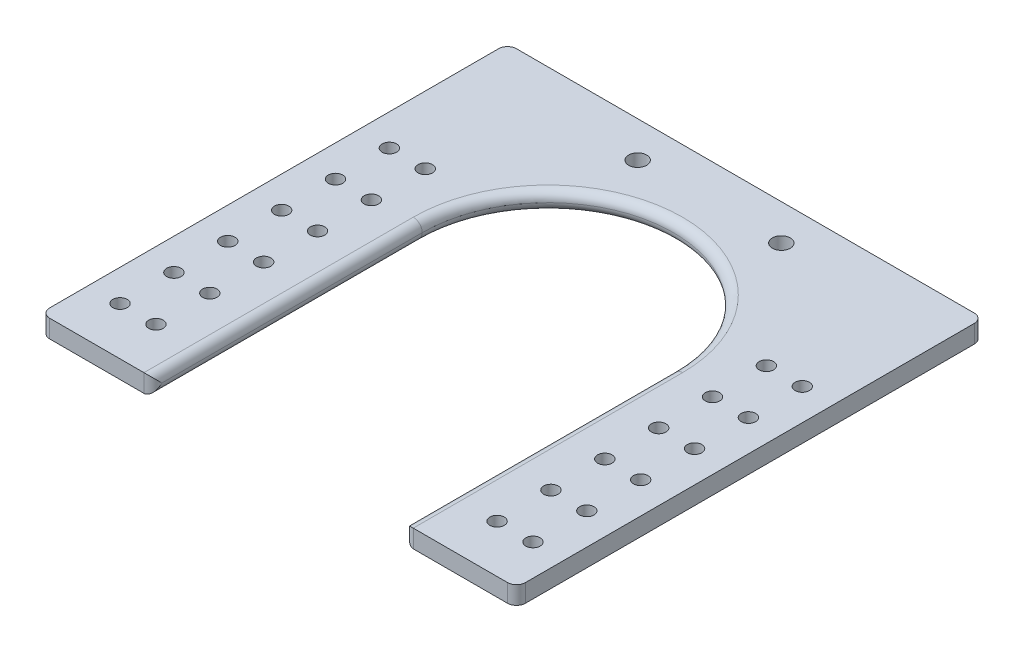
from build123d import *

# Parameters (mm, degrees)
SKETCH1_W                        = 168.275
SKETCH1_H                        = 165.1
BOSS_EXTRUDE1_DEPTH              = 3.175
CUT_EXTRUDE1_REACH               = 120.042
SKETCH2_R                        = 44.45
F_1_4_0_25_DIAMETER_HOLE1_D      = 6.35
F_1_4_0_25_DIAMETER_HOLE1_DEPTH  = 25.4
F_1_4_0_25_DIAMETER_HOLE1_TIP    = 1.907732465
F_1_4_20_TAPPED_HOLE1_AT_2_COUNT = 2
F_1_4_20_TAPPED_HOLE1_AT_2_PITCH = 12.7
LPATTERN1_COUNT                  = 6
LPATTERN1_PITCH                  = 19.05
FILLET1_R                        = 3.175
FILLET2_R                        = 3.175


with BuildPart() as part:
    # Sketch1 → Boss-Extrude1 (new, symmetric)
    with BuildSketch(Plane(origin=(0, 0, 0), x_dir=(1, 0, 0), z_dir=(0, 1, 0))):
        Rectangle(SKETCH1_W, SKETCH1_H)
    extrude(amount=BOSS_EXTRUDE1_DEPTH, both=True)

    # Sketch2 → Cut-Extrude1 (cut, up to next)
    with BuildSketch(Plane(origin=(0, 3.175, 0), x_dir=(1, 0, 0), z_dir=(0, 1, 0)), mode=Mode.PRIVATE) as cut_extrude1_sk1:
        with Locations((0, 12.7)):
            Circle(SKETCH2_R)
    cut_extrude1_tool1 = extrude(cut_extrude1_sk1.sketch, amount=-CUT_EXTRUDE1_REACH, mode=Mode.PRIVATE) & part.part
    # Sketch2 → Cut-Extrude1 (cut, up to next)
    with BuildSketch(Plane(origin=(0, 3.175, 0), x_dir=(1, 0, 0), z_dir=(0, 1, 0)), mode=Mode.PRIVATE) as cut_extrude1_sk2:
        with BuildLine():
            Line((44.45, -82.55), (44.45, 12.7))
            ThreePointArc((44.45, 12.7), (0, -31.75), (-44.45, 12.7))
            Line((-44.45, 12.7), (-44.45, -82.55))
            Line((-44.45, -82.55), (44.45, -82.55))
        make_face()
    cut_extrude1_tool2 = extrude(cut_extrude1_sk2.sketch, amount=-CUT_EXTRUDE1_REACH, mode=Mode.PRIVATE) & part.part
    add(cut_extrude1_tool1.solids().sort_by_distance((0, 3.175, -12.7))[0], mode=Mode.SUBTRACT)
    add(cut_extrude1_tool2.solids().sort_by_distance((0, 3.175, 51.564855))[0], mode=Mode.SUBTRACT)

    # 1/4 (0.25) Diameter Hole1
    with Locations(Plane(origin=(0, 3.175, 0), x_dir=(1, 0, 0), z_dir=(0, 1, 0))):
        with Locations((-25.4, 69.85), (25.4, 69.85)):
            Hole(F_1_4_0_25_DIAMETER_HOLE1_D / 2, depth=F_1_4_0_25_DIAMETER_HOLE1_DEPTH)
            with Locations((0, 0, -(F_1_4_0_25_DIAMETER_HOLE1_DEPTH + F_1_4_0_25_DIAMETER_HOLE1_TIP / 2))):  # 118° drill point
                Cone(0, F_1_4_0_25_DIAMETER_HOLE1_D / 2, F_1_4_0_25_DIAMETER_HOLE1_TIP, mode=Mode.SUBTRACT)

    # Sketch10 → 1/4-20 Tapped Hole1 (revolve, cut)
    with BuildSketch(Plane(origin=(-73.025, 3.175, 65.603705108), x_dir=(0, 0, 1), z_dir=(1, 0, 0))):
        Polygon((0, 0), (0, 26.933816902), (2.5527, 25.4), (2.5527, 0), align=None)
    f_1_4_20_tapped_hole1 = revolve(axis=Axis((-73.025, 9.525, 65.603705108), (0, -1, 0)), mode=Mode.SUBTRACT)

    # 1/4-20 Tapped Hole1 at 2: 1/4-20 Tapped Hole1 ×2
    with Locations(*[(i * F_1_4_20_TAPPED_HOLE1_AT_2_PITCH, 0, 0) for i in range(1, F_1_4_20_TAPPED_HOLE1_AT_2_COUNT)]):
        add(f_1_4_20_tapped_hole1, mode=Mode.SUBTRACT)

    # LPattern1: 1/4-20 Tapped Hole1 ×6
    with Locations(*[(0, 0, -i * LPATTERN1_PITCH) for i in range(1, LPATTERN1_COUNT)]):
        add(f_1_4_20_tapped_hole1, mode=Mode.SUBTRACT)

    # LPattern1 copy 1 sketch → LPattern1 copy 1 (revolve, cut)
    with BuildSketch(Plane(origin=(-60.325, 3.175, 46.553705108), x_dir=(0, 0, 1), z_dir=(1, 0, 0))):
        Polygon((0, 0), (0, 26.933816902), (2.5527, 25.4), (2.5527, 0), align=None)
    revolve(axis=Axis((-60.325, 9.525, 46.553705108), (0, -1, 0)), mode=Mode.SUBTRACT)

    # LPattern1 copy 2 sketch → LPattern1 copy 2 (revolve, cut)
    with BuildSketch(Plane(origin=(-60.325, 3.175, 27.503705108), x_dir=(0, 0, 1), z_dir=(1, 0, 0))):
        Polygon((0, 0), (0, 26.933816902), (2.5527, 25.4), (2.5527, 0), align=None)
    revolve(axis=Axis((-60.325, 9.525, 27.503705108), (0, -1, 0)), mode=Mode.SUBTRACT)

    # LPattern1 copy 3 sketch → LPattern1 copy 3 (revolve, cut)
    with BuildSketch(Plane(origin=(-60.325, 3.175, 8.453705108), x_dir=(0, 0, 1), z_dir=(1, 0, 0))):
        Polygon((0, 0), (0, 26.933816902), (2.5527, 25.4), (2.5527, 0), align=None)
    revolve(axis=Axis((-60.325, 9.525, 8.453705108), (0, -1, 0)), mode=Mode.SUBTRACT)

    # LPattern1 copy 4 sketch → LPattern1 copy 4 (revolve, cut)
    with BuildSketch(Plane(origin=(-60.325, 3.175, -10.596294892), x_dir=(0, 0, 1), z_dir=(1, 0, 0))):
        Polygon((0, 0), (0, 26.933816902), (2.5527, 25.4), (2.5527, 0), align=None)
    revolve(axis=Axis((-60.325, 9.525, -10.596294892), (0, -1, 0)), mode=Mode.SUBTRACT)

    # LPattern1 copy 5 sketch → LPattern1 copy 5 (revolve, cut)
    with BuildSketch(Plane(origin=(-60.325, 3.175, -29.646294892), x_dir=(0, 0, 1), z_dir=(1, 0, 0))):
        Polygon((0, 0), (0, 26.933816902), (2.5527, 25.4), (2.5527, 0), align=None)
    revolve(axis=Axis((-60.325, 9.525, -29.646294892), (0, -1, 0)), mode=Mode.SUBTRACT)

    # Mirror1: 1/4-20 Tapped Hole1 across plane
    add(f_1_4_20_tapped_hole1.mirror(Plane(origin=(0, 0, 0), x_dir=(0, 0, 1), z_dir=(1, 0, 0))), mode=Mode.SUBTRACT)

    # Mirror1 copy 1 sketch → Mirror1 copy 1 (revolve, cut)
    with BuildSketch(Plane(origin=(60.325, 3.175, 65.603705108), x_dir=(0, 0, 1), z_dir=(-1, 0, 0))):
        Polygon((0, 0), (0, -26.933816902), (2.5527, -25.4), (2.5527, 0), align=None)
    revolve(axis=Axis((60.325, 9.525, 65.603705108), (0, 1, 0)), mode=Mode.SUBTRACT)

    # Mirror1 copy 2 sketch → Mirror1 copy 2 (revolve, cut)
    with BuildSketch(Plane(origin=(73.025, 3.175, 46.553705108), x_dir=(0, 0, 1), z_dir=(-1, 0, 0))):
        Polygon((0, 0), (0, -26.933816902), (2.5527, -25.4), (2.5527, 0), align=None)
    revolve(axis=Axis((73.025, 9.525, 46.553705108), (0, 1, 0)), mode=Mode.SUBTRACT)

    # Mirror1 copy 3 sketch → Mirror1 copy 3 (revolve, cut)
    with BuildSketch(Plane(origin=(73.025, 3.175, 27.503705108), x_dir=(0, 0, 1), z_dir=(-1, 0, 0))):
        Polygon((0, 0), (0, -26.933816902), (2.5527, -25.4), (2.5527, 0), align=None)
    revolve(axis=Axis((73.025, 9.525, 27.503705108), (0, 1, 0)), mode=Mode.SUBTRACT)

    # Mirror1 copy 4 sketch → Mirror1 copy 4 (revolve, cut)
    with BuildSketch(Plane(origin=(73.025, 3.175, 8.453705108), x_dir=(0, 0, 1), z_dir=(-1, 0, 0))):
        Polygon((0, 0), (0, -26.933816902), (2.5527, -25.4), (2.5527, 0), align=None)
    revolve(axis=Axis((73.025, 9.525, 8.453705108), (0, 1, 0)), mode=Mode.SUBTRACT)

    # Mirror1 copy 5 sketch → Mirror1 copy 5 (revolve, cut)
    with BuildSketch(Plane(origin=(73.025, 3.175, -10.596294892), x_dir=(0, 0, 1), z_dir=(-1, 0, 0))):
        Polygon((0, 0), (0, -26.933816902), (2.5527, -25.4), (2.5527, 0), align=None)
    revolve(axis=Axis((73.025, 9.525, -10.596294892), (0, 1, 0)), mode=Mode.SUBTRACT)

    # Mirror1 copy 6 sketch → Mirror1 copy 6 (revolve, cut)
    with BuildSketch(Plane(origin=(73.025, 3.175, -29.646294892), x_dir=(0, 0, 1), z_dir=(-1, 0, 0))):
        Polygon((0, 0), (0, -26.933816902), (2.5527, -25.4), (2.5527, 0), align=None)
    revolve(axis=Axis((73.025, 9.525, -29.646294892), (0, 1, 0)), mode=Mode.SUBTRACT)

    # Mirror1 copy 7 sketch → Mirror1 copy 7 (revolve, cut)
    with BuildSketch(Plane(origin=(60.325, 3.175, 46.553705108), x_dir=(0, 0, 1), z_dir=(-1, 0, 0))):
        Polygon((0, 0), (0, -26.933816902), (2.5527, -25.4), (2.5527, 0), align=None)
    revolve(axis=Axis((60.325, 9.525, 46.553705108), (0, 1, 0)), mode=Mode.SUBTRACT)

    # Mirror1 copy 8 sketch → Mirror1 copy 8 (revolve, cut)
    with BuildSketch(Plane(origin=(60.325, 3.175, 27.503705108), x_dir=(0, 0, 1), z_dir=(-1, 0, 0))):
        Polygon((0, 0), (0, -26.933816902), (2.5527, -25.4), (2.5527, 0), align=None)
    revolve(axis=Axis((60.325, 9.525, 27.503705108), (0, 1, 0)), mode=Mode.SUBTRACT)

    # Mirror1 copy 9 sketch → Mirror1 copy 9 (revolve, cut)
    with BuildSketch(Plane(origin=(60.325, 3.175, 8.453705108), x_dir=(0, 0, 1), z_dir=(-1, 0, 0))):
        Polygon((0, 0), (0, -26.933816902), (2.5527, -25.4), (2.5527, 0), align=None)
    revolve(axis=Axis((60.325, 9.525, 8.453705108), (0, 1, 0)), mode=Mode.SUBTRACT)

    # Mirror1 copy 10 sketch → Mirror1 copy 10 (revolve, cut)
    with BuildSketch(Plane(origin=(60.325, 3.175, -10.596294892), x_dir=(0, 0, 1), z_dir=(-1, 0, 0))):
        Polygon((0, 0), (0, -26.933816902), (2.5527, -25.4), (2.5527, 0), align=None)
    revolve(axis=Axis((60.325, 9.525, -10.596294892), (0, 1, 0)), mode=Mode.SUBTRACT)

    # Mirror1 copy 11 sketch → Mirror1 copy 11 (revolve, cut)
    with BuildSketch(Plane(origin=(60.325, 3.175, -29.646294892), x_dir=(0, 0, 1), z_dir=(-1, 0, 0))):
        Polygon((0, 0), (0, -26.933816902), (2.5527, -25.4), (2.5527, 0), align=None)
    revolve(axis=Axis((60.325, 9.525, -29.646294892), (0, 1, 0)), mode=Mode.SUBTRACT)

    # Fillet1
    fillet1_edges = [part.edges().sort_by_distance(p)[0] for p in [
        (-44.45, -3.175, 34.925),
        (0, -3.175, -57.15),
        (-44.45, 3.175, 34.925),
        (0, 3.175, -57.15),
        (44.45, -3.175, 34.925),
        (44.45, 3.175, 34.925),
        (84.1375, 0, 82.55),
        (44.45, 0, 82.55),
        (-84.1375, 0, 82.55),
        (-44.45, 0, 82.55),
    ]]
    fillet(fillet1_edges, radius=FILLET1_R - 0.0001)  # a hair under: the kernel refuses the full size

    # Fillet2
    fillet2_edges = [part.edges().sort_by_distance(p)[0] for p in [
        (84.1375, 0, -82.55),
        (-84.1375, 0, -82.55),
    ]]
    fillet(fillet2_edges, radius=FILLET2_R)


solid = part.part
